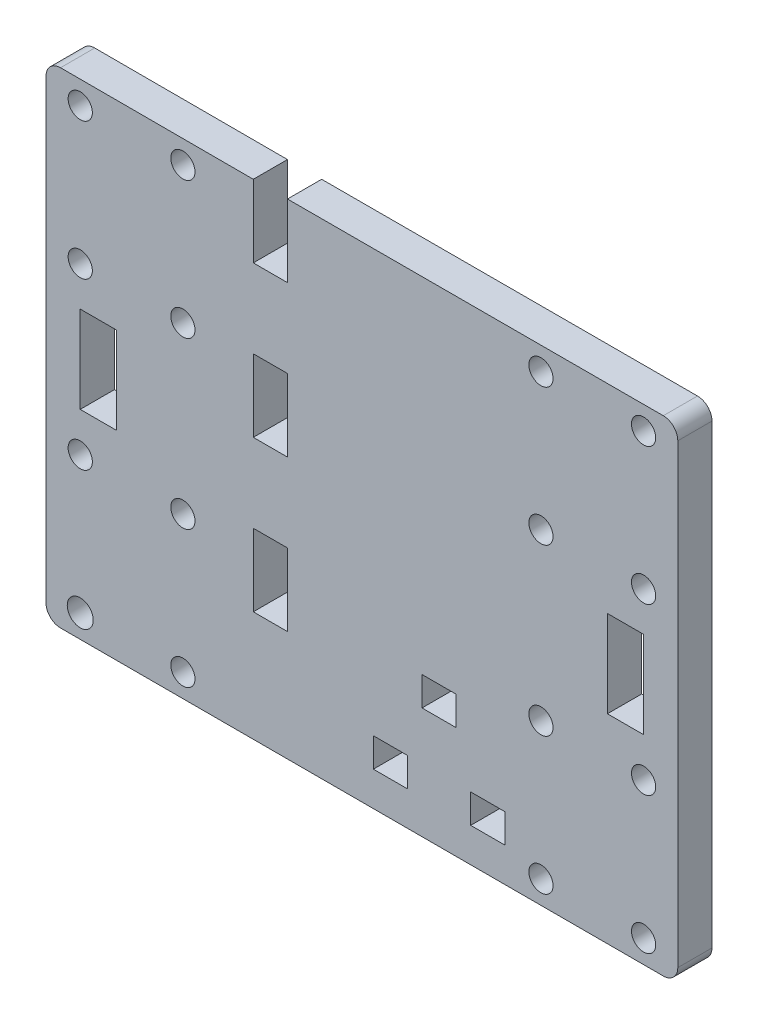
from build123d import *

# Parameters (mm, degrees)
SKETCH1_R           = 2.281562065
SKETCH1_R_2         = 2.125
SKETCH1_W           = 5.9944
SKETCH1_H           = 5.08
SKETCH1_H_2         = 12.7
BOSS_EXTRUDE1_DEPTH = 5.9944


with BuildPart() as part:
    # Sketch1 → Boss-Extrude1 (new body)
    with BuildSketch(Plane.XY):
        with BuildLine():
            Line((270.254984812, 144.069366268), (333.659384812, 144.069366268))
            Line((333.659384812, 144.069366268), (339.653784812, 144.069366268))
            Line((339.653784812, 144.069366268), (375.974984812, 144.069366268))
            ThreePointArc((375.974984812, 144.069366268), (377.771036036, 144.813315043), (378.514984812, 146.609366268))
            Line((378.514984812, 146.609366268), (378.514984812, 226.632730682))
            ThreePointArc((378.514984812, 226.632730682), (377.770473259, 228.429344507), (375.973393287, 229.172730183))
            Line((375.973393287, 229.172730183), (310.059384812, 229.131429486))
            Line((310.059384812, 229.131429486), (310.059384812, 216.431429486))
            Line((310.059384812, 216.431429486), (304.064984812, 216.431429486))
            Line((304.064984812, 216.431429486), (304.064984812, 229.131429486))
            Line((304.064984812, 229.131429486), (270.257982025, 229.171321953))
            ThreePointArc((270.257982025, 229.171321953), (268.459993575, 228.428434308), (267.714984812, 226.631323721))
            Line((267.714984812, 226.631323721), (267.714984812, 146.609366268))
            ThreePointArc((267.714984812, 146.609366268), (268.458933587, 144.813315043), (270.254984812, 144.069366268))
        make_face()
        with Locations((273.714984812, 148.112259486)):
            Circle(SKETCH1_R, mode=Mode.SUBTRACT)
        with Locations((291.714984812, 148.112259486)):
            Circle(SKETCH1_R_2, mode=Mode.SUBTRACT)
        with Locations((328.122184812, 152.603766267)):
            Rectangle(SKETCH1_W, SKETCH1_H, mode=Mode.SUBTRACT)
        with Locations((354.514984812, 148.112259486)):
            Circle(SKETCH1_R_2, mode=Mode.SUBTRACT)
        with Locations((345.190984812, 152.603766267)):
            Rectangle(SKETCH1_W, SKETCH1_H, mode=Mode.SUBTRACT)
        with Locations((273.714984812, 172.112259486)):
            Circle(SKETCH1_R_2, mode=Mode.SUBTRACT)
        with Locations((307.062184812, 169.781429486)):
            Rectangle(SKETCH1_W, SKETCH1_H_2, mode=Mode.SUBTRACT)
        with Locations((291.714984812, 172.112259486)):
            Circle(SKETCH1_R_2, mode=Mode.SUBTRACT)
        Polygon((273.709384812, 179.000344994), (273.709384812, 186.620344994), (273.709384812, 194.240344994), (280.059384812, 194.240344994), (280.059384812, 179.000344994), align=None, mode=Mode.SUBTRACT)
        with Locations((336.656584812, 166.168316361)):
            Rectangle(SKETCH1_W, SKETCH1_H, mode=Mode.SUBTRACT)
        with Locations((354.514984812, 172.112259486)):
            Circle(SKETCH1_R_2, mode=Mode.SUBTRACT)
        with Locations((372.514984812, 148.112259486)):
            Circle(SKETCH1_R_2, mode=Mode.SUBTRACT)
        with Locations((372.514984812, 172.112259486)):
            Circle(SKETCH1_R_2, mode=Mode.SUBTRACT)
        Polygon((372.520584812, 186.620344994), (372.520584812, 179.000344994), (366.170584812, 179.000344994), (366.170584812, 194.240344994), (372.520584812, 194.240344994), align=None, mode=Mode.SUBTRACT)
        with Locations((307.062184812, 196.281429486)):
            Rectangle(SKETCH1_W, SKETCH1_H_2, mode=Mode.SUBTRACT)
        with Locations((273.714984812, 201.131429486)):
            Circle(SKETCH1_R_2, mode=Mode.SUBTRACT)
        with Locations((291.714984812, 201.131429486)):
            Circle(SKETCH1_R_2, mode=Mode.SUBTRACT)
        with Locations((354.514984812, 201.131429486)):
            Circle(SKETCH1_R_2, mode=Mode.SUBTRACT)
        with Locations((273.714984812, 225.131429486)):
            Circle(SKETCH1_R_2, mode=Mode.SUBTRACT)
        with Locations((291.714984812, 225.131429486)):
            Circle(SKETCH1_R_2, mode=Mode.SUBTRACT)
        with Locations((354.514984812, 225.131429486)):
            Circle(SKETCH1_R_2, mode=Mode.SUBTRACT)
        with Locations((372.514984812, 201.131429486)):
            Circle(SKETCH1_R_2, mode=Mode.SUBTRACT)
        with Locations((372.514984812, 225.131429486)):
            Circle(SKETCH1_R_2, mode=Mode.SUBTRACT)
    extrude(amount=BOSS_EXTRUDE1_DEPTH)


solid = part.part
